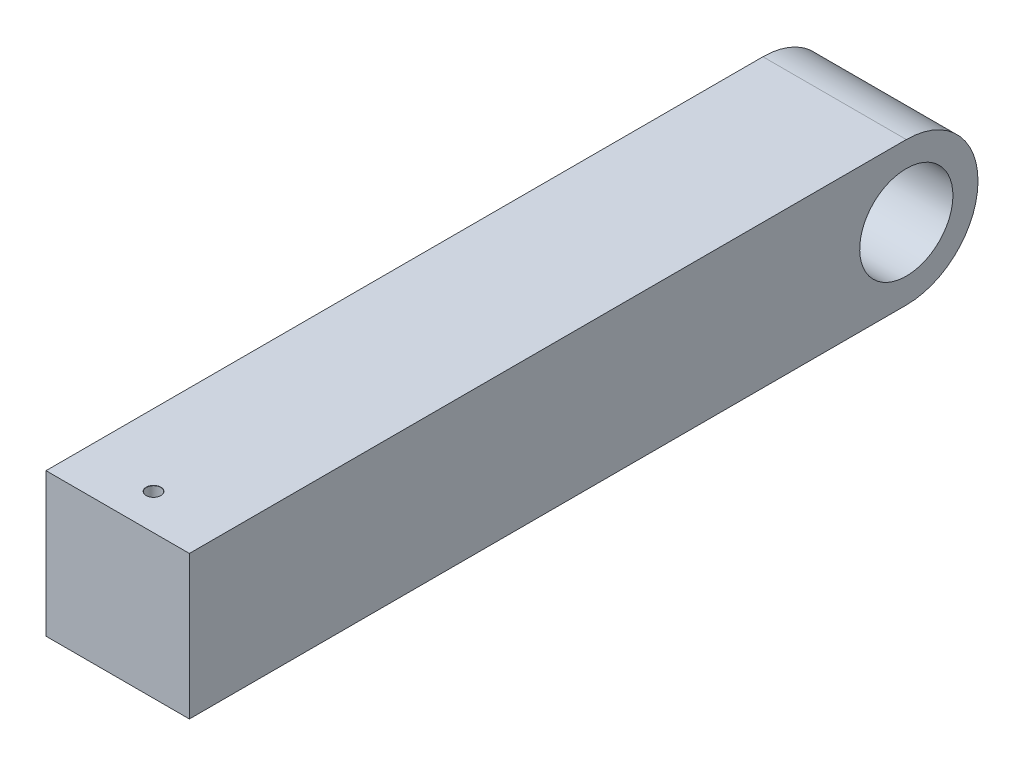
from build123d import *

# Parameters (mm, degrees)
SKETCH1_W                       = 20
SKETCH1_H                       = 20
BOSS_EXTRUDE1_DEPTH             = 110
FILLET1_R                       = 10
SKETCH2_R                       = 6.5
CUT_EXTRUDE1_DEPTH              = 20
F_2_0MM_DOWEL_HOLE1_D           = 2
F_2_0MM_DOWEL_HOLE1_CSINK_D     = 2.05
F_2_0MM_DOWEL_HOLE1_CSINK_ANGLE = 90


with BuildPart() as part:
    # Sketch1 → Boss-Extrude1 (new body)
    with BuildSketch(Plane(origin=(0, 0, 0), x_dir=(0, 1, 0), z_dir=(0, 0, 1))):
        Rectangle(SKETCH1_W, SKETCH1_H)
    extrude(amount=-BOSS_EXTRUDE1_DEPTH)

    # Fillet1
    fillet1_edges = [part.edges().sort_by_distance(p)[0] for p in [
        (0, -10, -110),
        (0, 10, -110),
    ]]
    fillet(fillet1_edges, radius=FILLET1_R - 0.0001)  # a hair under: the kernel refuses the full size

    # Sketch2 → Cut-Extrude1 (cut)
    with BuildSketch(Plane.YZ.offset(10)):
        with Locations((0, -100)):
            Circle(SKETCH2_R)
    extrude(amount=-CUT_EXTRUDE1_DEPTH, mode=Mode.SUBTRACT)

    # Ø2.0mm Dowel Hole1 (through all)
    with Locations(Plane.XZ.offset(10)):
        with Locations((0, -5)):
            f_2_0mm_dowel_hole1 = CounterSinkHole(F_2_0MM_DOWEL_HOLE1_D / 2, F_2_0MM_DOWEL_HOLE1_CSINK_D / 2, counter_sink_angle=F_2_0MM_DOWEL_HOLE1_CSINK_ANGLE)

    # Mirror1: Ø2.0mm Dowel Hole1 across plane
    add(f_2_0mm_dowel_hole1.mirror(Plane.ZX), mode=Mode.SUBTRACT)


solid = part.part
